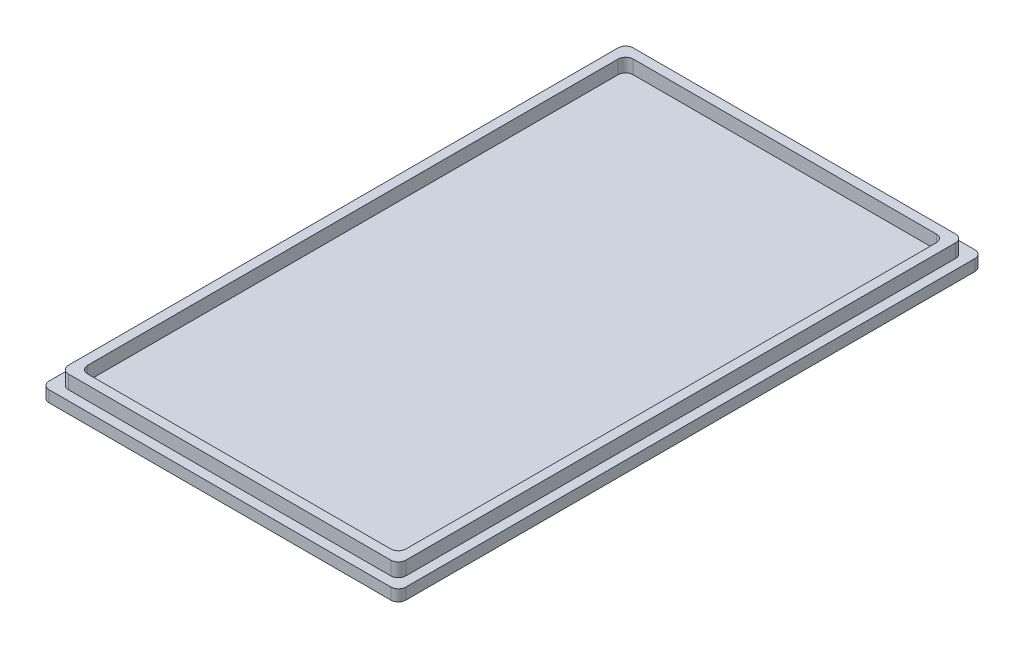
from build123d import *

# Parameters (mm, degrees)
SKETCH1_W           = 47.09116882
SKETCH1_H           = 77.09116882
BOSS_EXTRUDE1_DEPTH = 1.5
SKETCH2_W           = 44.545584412
SKETCH2_H           = 74.545584412
SKETCH2_W_2         = 42
SKETCH2_H_2         = 72
BOSS_EXTRUDE2_DEPTH = 1.8
FILLET1_R           = 1


with BuildPart() as part:
    # Sketch1 → Boss-Extrude1 (new body)
    with BuildSketch(Plane(origin=(0, 0, 0), x_dir=(1, 0, 0), z_dir=(0, 1, 0))):
        with Locations((23.54558441, -38.54558441)):
            Rectangle(SKETCH1_W, SKETCH1_H)
    extrude(amount=BOSS_EXTRUDE1_DEPTH)

    # Sketch2 → Boss-Extrude2 (add)
    with BuildSketch(Plane(origin=(0, 1.5, 0), x_dir=(1, 0, 0), z_dir=(0, 1, 0))):
        with Locations((23.545584412, -38.545584412)):
            Rectangle(SKETCH2_W, SKETCH2_H)
        with Locations((23.545584412, -38.545584412)):
            Rectangle(SKETCH2_W_2, SKETCH2_H_2, mode=Mode.SUBTRACT)
    extrude(amount=BOSS_EXTRUDE2_DEPTH)

    # Fillet1
    fillet1_edges = [part.edges().sort_by_distance(p)[0] for p in [
        (2.545584412, 2.4, 2.545584412),
        (1.272792206, 2.4, 1.272792206),
        (0, 0.75, 0),
        (2.545584412, 2.4, 74.545584412),
        (1.272792206, 2.4, 75.818376618),
        (0, 0.75, 77.09116882),
        (44.545584412, 2.4, 74.545584412),
        (47.09116882, 0.75, 77.09116882),
        (45.818376618, 2.4, 75.818376618),
        (44.545584412, 2.4, 2.545584412),
        (47.09116882, 0.75, 0),
        (45.818376618, 2.4, 1.272792206),
    ]]
    fillet(fillet1_edges, radius=FILLET1_R)


solid = part.part
